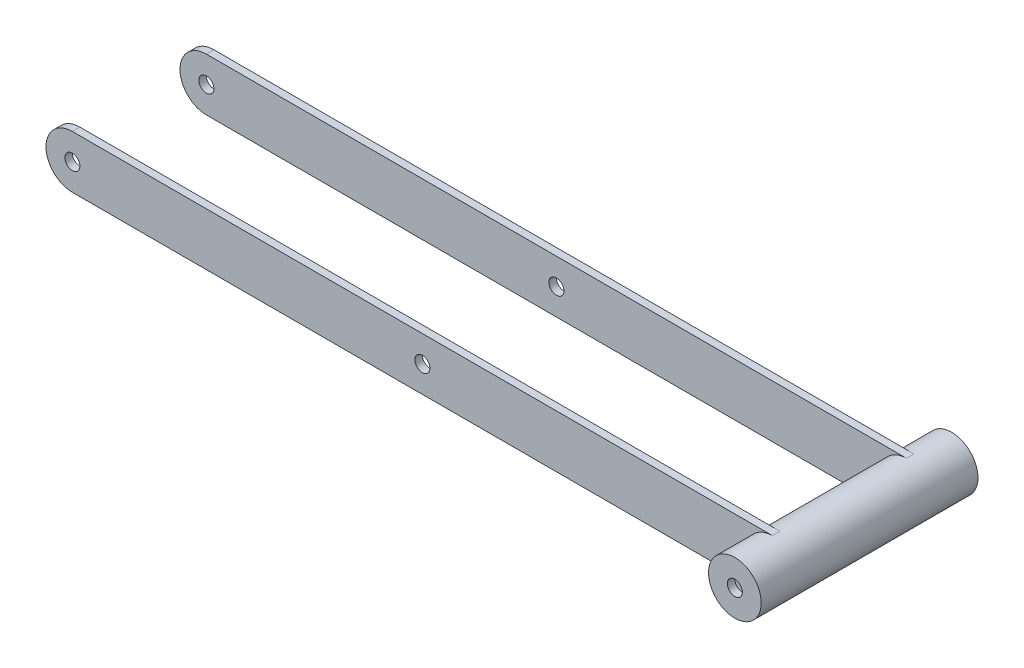
from build123d import *

# Parameters (mm, degrees)
SKETCH3_W           = 500
SKETCH3_H           = 94
BOSS_EXTRUDE3_DEPTH = 17.5
FILLET2_R           = 17.5
SKETCH4_W           = 500
SKETCH4_H           = 84
CUT_EXTRUDE2_DEPTH  = 35
SKETCH9_R           = 5
CUT_EXTRUDE4_DEPTH  = 268.660699394
SKETCH5_R           = 17.5
BOSS_EXTRUDE4_DEPTH = 72
SKETCH8_R           = 5
CUT_EXTRUDE3_DEPTH  = 5


with BuildPart() as part:
    # Sketch3 → Boss-Extrude3 (new, symmetric)
    with BuildSketch(Plane(origin=(0, 0, 0), x_dir=(1, 0, 0), z_dir=(0, 1, 0))):
        Rectangle(SKETCH3_W, SKETCH3_H)
    extrude(amount=BOSS_EXTRUDE3_DEPTH, both=True)

    # Fillet2
    fillet2_edges = [part.edges().sort_by_distance(p)[0] for p in [
        (250, -17.5, 0),
        (250, 17.5, 0),
        (-250, -17.5, 0),
        (-250, 17.5, 0),
    ]]
    fillet(fillet2_edges, radius=FILLET2_R - 0.0001)  # a hair under: the kernel refuses the full size

    # Sketch4 → Cut-Extrude2 (cut)
    with BuildSketch(Plane(origin=(0, 17.5, 0), x_dir=(1, 0, 0), z_dir=(0, 1, 0))):
        Rectangle(SKETCH4_W, SKETCH4_H)
    extrude(amount=-CUT_EXTRUDE2_DEPTH, mode=Mode.SUBTRACT)


with BuildPart() as cut_extrude2_piece_1:
    # of the separate pieces the step leaves, piece 1, a body of its own (cut_extrude2_pieces)
    add(part.part.solids().sort_by_distance((-250, -0.0001, -47))[0])


with BuildPart() as cut_extrude2_piece_2:
    # of the separate pieces the step leaves, piece 2, a body of its own (cut_extrude2_pieces)
    add(part.part.solids().sort_by_distance((-250, -0.0001, 47))[0])


with BuildPart() as cut_extrude4_tool:
    # Sketch9 → Cut-Extrude4 (new, through all)
    with BuildSketch(Plane(origin=(0, 0, -47), x_dir=(-1, 0, 0), z_dir=(0, 0, -1))):
        Circle(SKETCH9_R)
        with Locations((232.5, 0)):
            Circle(SKETCH9_R)
    extrude(amount=-CUT_EXTRUDE4_DEPTH)


with BuildPart() as cut_extrude2_piece_1_1:
    add(cut_extrude2_piece_1.part)

    # Cut-Extrude4: cut by cut_extrude4_tool
    add(cut_extrude4_tool.part, mode=Mode.SUBTRACT)



with BuildPart() as cut_extrude2_piece_2_1:
    add(cut_extrude2_piece_2.part)

    # Cut-Extrude4: cut by cut_extrude4_tool
    add(cut_extrude4_tool.part, mode=Mode.SUBTRACT)


with BuildPart() as cut_extrude2_piece_1_2:
    add(cut_extrude2_piece_1_1.part)

    add(cut_extrude2_piece_2_1.part)  # Boss-Extrude4 merges Cut-Extrude2 piece 2
    # Sketch5 → Boss-Extrude4 (add, symmetric)
    with BuildSketch(Plane.XY):
        with Locations((232.5, 0)):
            Circle(SKETCH5_R)
    extrude(amount=BOSS_EXTRUDE4_DEPTH, both=True)

    # Sketch8 → Cut-Extrude3 (cut)
    with BuildSketch(Plane(origin=(0, 0, -72), x_dir=(-1, 0, 0), z_dir=(0, 0, -1))):
        with Locations((-232.5, 0)):
            Circle(SKETCH8_R)
    cut_extrude3 = extrude(amount=-CUT_EXTRUDE3_DEPTH, mode=Mode.SUBTRACT)

    # Mirror1: Cut-Extrude3 across plane
    add(cut_extrude3.mirror(Plane.XY), mode=Mode.SUBTRACT)


solid = cut_extrude2_piece_1_2.part
